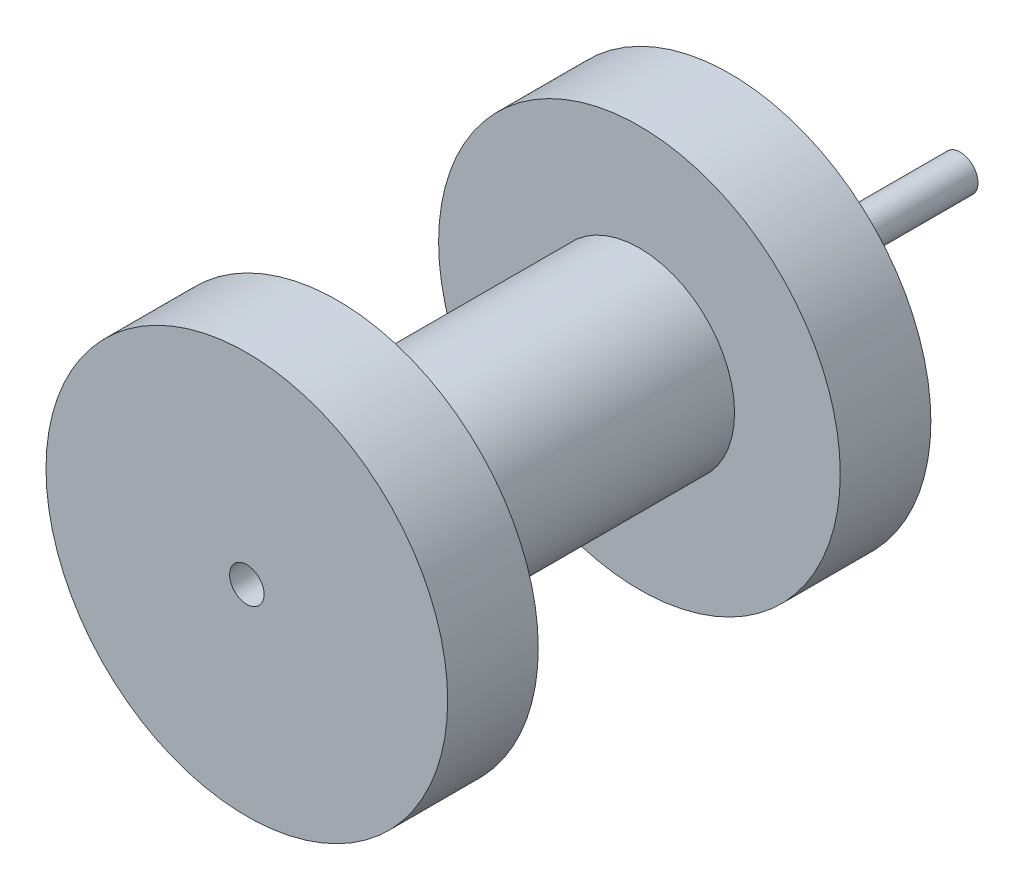
from build123d import *

# Parameters (mm, degrees)
SKETCH1_R            = 1.500124
BOSS_EXTRUDE1_DEPTH  = 29.9974
SHELL3_T             = -0.0508
SKETCH5_R            = 16.891
SKETCH5_R_2          = 1.449324
BOSS_EXTRUDE8_DEPTH  = 7.62
SKETCH6_R            = 7.9999967
SKETCH6_R_2          = 7.62
BOSS_EXTRUDE9_DEPTH  = 25.4
SKETCH7_R            = 16.891
SKETCH7_R_2          = 1.500124
BOSS_EXTRUDE10_DEPTH = 7.62
SKETCH8_R            = 7.9999967
SKETCH8_R_2          = 1.449324
BOSS_EXTRUDE11_DEPTH = 2.54


with BuildPart() as part:
    # Sketch1 → Boss-Extrude1 (new, symmetric)
    with BuildSketch(Plane.XY):
        Circle(SKETCH1_R)
    extrude(amount=BOSS_EXTRUDE1_DEPTH, both=True)

    # Shell3
    shell3_openings = [part.faces().sort_by_distance(p)[0] for p in [
        (0, 0, -29.9974),
        (0, 0, 29.9974),
    ]]
    offset(amount=SHELL3_T, openings=shell3_openings, kind=Kind.INTERSECTION)

    # Sketch5 → Boss-Extrude8 (add)
    with BuildSketch(Plane.XY.offset(29.9974)):
        Circle(SKETCH5_R)
        Circle(SKETCH5_R_2, mode=Mode.SUBTRACT)
    extrude(amount=-BOSS_EXTRUDE8_DEPTH)

    # Sketch6 → Boss-Extrude9 (add)
    with BuildSketch(Plane(origin=(0, 0, 22.3774), x_dir=(-1, 0, 0), z_dir=(0, 0, -1))):
        Circle(SKETCH6_R)
        Circle(SKETCH6_R_2, mode=Mode.SUBTRACT)
    extrude(amount=BOSS_EXTRUDE9_DEPTH)

    # Sketch7 → Boss-Extrude10 (add)
    with BuildSketch(Plane(origin=(0, 0, -3.0226), x_dir=(-1, 0, 0), z_dir=(0, 0, -1))):
        Circle(SKETCH7_R)
        Circle(SKETCH7_R_2, mode=Mode.SUBTRACT)
    extrude(amount=BOSS_EXTRUDE10_DEPTH)

    # Sketch8 → Boss-Extrude11 (add)
    with BuildSketch(Plane.XY.offset(29.9974)):
        Circle(SKETCH8_R)
        Circle(SKETCH8_R_2, mode=Mode.SUBTRACT)
    extrude(amount=-BOSS_EXTRUDE11_DEPTH)


solid = part.part
